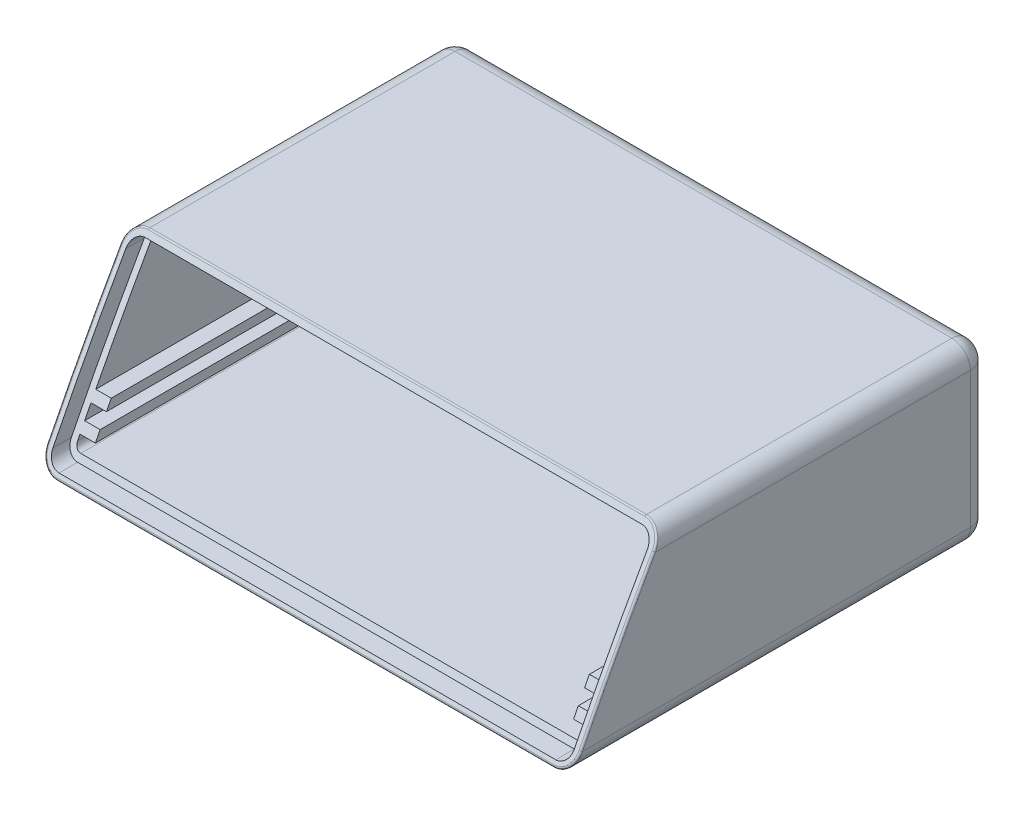
from build123d import *

# Parameters (mm, degrees)
SKETCH1_W                = 86.28
SKETCH1_H                = 67.5
BOSS_EXTRUDE1_DEPTH      = 28
FILLET1_R                = 3
SHELL1_T                 = -2
CUT_EXTRUDE1_DEPTH       = 97.784817508
SKETCH3_W                = 14.3
SKETCH3_H                = 16.7
SKETCH3_W_2              = 11.05
SKETCH3_H_2              = 14.049996967
CUT_EXTRUDE2_DEPTH       = 2
FILLET2_R                = 3
CUT_EXTRUDE3_REACH       = 165.279
CUT_EXTRUDE3_END_RADIUS  = 475
CUT_EXTRUDE3_START       = 80
FILLET3_R                = 0.3
BOSS_EXTRUDE2_REACH      = 85.135
BOSS_EXTRUDE2_END_RADIUS = 475
SKETCH5_W                = 2.5
SKETCH5_H                = 1.5


with BuildPart() as part:
    # Sketch1 → Boss-Extrude1 (new body)
    with BuildSketch(Plane(origin=(0, 0, 0), x_dir=(1, 0, 0), z_dir=(0, 1, 0))):
        Rectangle(SKETCH1_W, SKETCH1_H)
    extrude(amount=BOSS_EXTRUDE1_DEPTH)

    # Fillet1
    fillet1_edges = [part.edges().sort_by_distance(p)[0] for p in [
        (-43.14, 28, 0),
        (43.14, 28, 0),
        (-43.14, 0, 0),
        (43.14, 0, 0),
    ]]
    fillet(fillet1_edges, radius=FILLET1_R)

    # Shell1
    shell1_openings = [part.faces().sort_by_distance(p)[0] for p in [
        (0, 14, 33.75),
    ]]
    offset(amount=SHELL1_T, openings=shell1_openings, kind=Kind.INTERSECTION)

    # Sketch2 → Cut-Extrude1 (cut, through all)
    with BuildSketch(Plane.ZY.offset(43.14)):
        with BuildLine():
            Line((18.75, 28), (33.75, 28))
            Line((33.75, 28), (33.75, 0))
            ThreePointArc((33.75, 0), (26.484121584, 14.125422277), (18.75, 28))
        make_face()
    extrude(amount=-CUT_EXTRUDE1_DEPTH, mode=Mode.SUBTRACT)

    # Sketch3 → Cut-Extrude2 (cut)
    with BuildSketch(Plane(origin=(0, 0, -33.75), x_dir=(-1, 0, 0), z_dir=(0, 0, -1))):
        with Locations((0, 10.35)):
            Rectangle(SKETCH3_W, SKETCH3_H)
        with Locations((32.775, 10.175001517)):
            Rectangle(SKETCH3_W_2, SKETCH3_H_2)
    extrude(amount=-CUT_EXTRUDE2_DEPTH, mode=Mode.SUBTRACT)

    # Fillet2
    # the kernel refuses this fillet: 3 mm, written as the material it takes off along each edge
    with BuildSketch(Plane(origin=(40.14, 25, -33.75), x_dir=(1, 0, 0), z_dir=(0, -1, 0))) as fillet2_piece_1:
        with BuildLine():
            CenterArc((3 - FILLET2_R, FILLET2_R), FILLET2_R, 270, 90)
            Line((3, FILLET2_R), (3, 0))
            Line((3, 0), (3 - FILLET2_R, 0))
        make_face()
    revolve(axis=Axis((40.14, 25, -33.75), (0, 0, 1)), revolution_arc=90, mode=Mode.SUBTRACT)
    with BuildSketch(Plane(origin=(43.14, 3, -33.75), x_dir=(-1, 0, 0), z_dir=(0, 1, 0)), Plane(origin=(-43.14, 3, -33.75), x_dir=(0, 0, 1), z_dir=(0, 1, 0))) as fillet2_piece_2:
        with BuildLine():
            CenterArc((FILLET2_R, FILLET2_R), FILLET2_R, 180, 90)
            Line((0, FILLET2_R), (0, 0))
            Line((0, 0), (FILLET2_R, 0))
        make_face()
    extrude(amount=22, mode=Mode.SUBTRACT)
    with BuildSketch(Plane(origin=(40.14, 3, -33.75), x_dir=(1, 0, 0), z_dir=(0, 1, 0))) as fillet2_piece_3:
        with BuildLine():
            CenterArc((3 - FILLET2_R, -FILLET2_R), FILLET2_R, 0, 90)
            Line((3, -FILLET2_R), (3, 0))
            Line((3, 0), (3 - FILLET2_R, 0))
        make_face()
    revolve(axis=Axis((40.14, 3, -33.75), (0, 0, -1)), revolution_arc=90, mode=Mode.SUBTRACT)
    with BuildSketch(Plane(origin=(40.14, 0, -33.75), x_dir=(0, 1, 0), z_dir=(-1, 0, 0))) as fillet2_piece_4:
        with BuildLine():
            CenterArc((FILLET2_R, -FILLET2_R), FILLET2_R, 90, 90)
            Line((0, -FILLET2_R), (0, 0))
            Line((0, 0), (FILLET2_R, 0))
        make_face()
    extrude(amount=80.28, mode=Mode.SUBTRACT)
    with BuildSketch(Plane(origin=(-40.14, 3, -33.75), x_dir=(-1, 0, 0), z_dir=(0, 1, 0))) as fillet2_piece_5:
        with BuildLine():
            CenterArc((3 - FILLET2_R, FILLET2_R), FILLET2_R, 270, 90)
            Line((3 - FILLET2_R, 0), (3, 0))
            Line((3, 0), (3, FILLET2_R))
        make_face()
    revolve(axis=Axis((-40.14, 3, -33.75), (0, 0, 1)), revolution_arc=90, mode=Mode.SUBTRACT)
    with BuildSketch(Plane(origin=(-40.14, 25, -33.75), x_dir=(-1, 0, 0), z_dir=(0, -1, 0))) as fillet2_piece_6:
        with BuildLine():
            CenterArc((3 - FILLET2_R, -FILLET2_R), FILLET2_R, 0, 90)
            Line((3 - FILLET2_R, 0), (3, 0))
            Line((3, 0), (3, -FILLET2_R))
        make_face()
    revolve(axis=Axis((-40.14, 25, -33.75), (0, 0, -1)), revolution_arc=90, mode=Mode.SUBTRACT)
    with BuildSketch(Plane(origin=(40.14, 28, -33.75), x_dir=(0, -1, 0), z_dir=(-1, 0, 0))) as fillet2_piece_7:
        with BuildLine():
            CenterArc((FILLET2_R, FILLET2_R), FILLET2_R, 180, 90)
            Line((0, FILLET2_R), (0, 0))
            Line((0, 0), (FILLET2_R, 0))
        make_face()
    extrude(amount=80.28, mode=Mode.SUBTRACT)

    # Cut-Extrude3: up to this cylinder (the profile starts outside it)
    cut_extrude3_end = Plane(origin=(0, -210.179748667, -395.218864179), z_dir=(-1, 0, 0)) * Cylinder(CUT_EXTRUDE3_END_RADIUS, 1281.558, mode=Mode.PRIVATE)
    # Sketch4 → Cut-Extrude3 (cut, up to the surface)
    with BuildSketch(Plane.XY.offset(-31.75).offset(CUT_EXTRUDE3_START), mode=Mode.PRIVATE) as cut_extrude3_sk1:
        with BuildLine():
            Line((-7.15, 1), (7.15, 1))
            Line((7.15, 1), (40.14, 1))
            ThreePointArc((40.14, 1), (41.554213562, 1.585786438), (42.14, 3))
            Line((42.14, 3), (42.14, 25))
            ThreePointArc((42.14, 25), (41.554213562, 26.414213562), (40.14, 27))
            Line((40.14, 27), (-40.14, 27))
            ThreePointArc((-40.14, 27), (-41.554213562, 26.414213562), (-42.14, 25))
            Line((-42.14, 25), (-42.14, 3))
            ThreePointArc((-42.14, 3), (-41.554213562, 1.585786438), (-40.14, 1))
            Line((-40.14, 1), (-7.15, 1))
        make_face()
        with BuildLine():
            Line((-7.15, 2), (7.15, 2))
            Line((7.15, 2), (40.14, 2))
            ThreePointArc((40.14, 2), (40.847106781, 2.292893219), (41.14, 3))
            Line((41.14, 3), (41.14, 25))
            ThreePointArc((41.14, 25), (40.847106781, 25.707106781), (40.14, 26))
            Line((40.14, 26), (-40.14, 26))
            ThreePointArc((-40.14, 26), (-40.847106781, 25.707106781), (-41.14, 25))
            Line((-41.14, 25), (-41.14, 3))
            ThreePointArc((-41.14, 3), (-40.847106781, 2.292893219), (-40.14, 2))
            Line((-40.14, 2), (-7.15, 2))
        make_face(mode=Mode.SUBTRACT)
    cut_extrude3_tool1 = extrude(cut_extrude3_sk1.sketch, amount=-CUT_EXTRUDE3_REACH, mode=Mode.PRIVATE) - cut_extrude3_end
    add(cut_extrude3_tool1.solids().sort_by_distance((0, 26.118007, 48.25))[0], mode=Mode.SUBTRACT)

    # Fillet3
    fillet3_edges = [part.edges().sort_by_distance(p)[0] for p in [
        (0, 0, 33.75),
        (-43.14, 14.077394683, 26.509847108),
        (42.334331752, 27.045704827, 19.301590008),
        (42.31956234, 0.938566512, 33.285609346),
        (-42.31956234, 0.938566512, 33.285609346),
        (-42.334331752, 27.045704827, 19.301590008),
        (43.14, 14.077394683, 26.509847108),
        (0, 28, 18.75),
    ]]
    fillet(fillet3_edges, radius=FILLET3_R)

    # Boss-Extrude2: up to this cylinder (the profile starts inside it)
    boss_extrude2_end = Plane(origin=(0, -210.179748667, -395.218864179), z_dir=(-1, 0, 0)) * Cylinder(BOSS_EXTRUDE2_END_RADIUS, 1201.05, mode=Mode.PRIVATE)
    # Sketch5 → Boss-Extrude2 (add, up to the surface)
    with BuildSketch(Plane.XY.offset(-31.75), mode=Mode.PRIVATE) as boss_extrude2_sk1:
        with Locations((39.89, 4.5)):
            Rectangle(SKETCH5_W, SKETCH5_H)
    boss_extrude2_tool1 = extrude(boss_extrude2_sk1.sketch, amount=BOSS_EXTRUDE2_REACH, mode=Mode.PRIVATE) & boss_extrude2_end
    add(boss_extrude2_tool1.solids().sort_by_distance((39.89, 4.5, -31.75))[0])
    # Sketch5 → Boss-Extrude2 (add, up to the surface)
    with BuildSketch(Plane.XY.offset(-31.75), mode=Mode.PRIVATE) as boss_extrude2_sk2:
        with Locations((39.89, 8)):
            Rectangle(SKETCH5_W, SKETCH5_H)
    boss_extrude2_tool2 = extrude(boss_extrude2_sk2.sketch, amount=BOSS_EXTRUDE2_REACH, mode=Mode.PRIVATE) & boss_extrude2_end
    add(boss_extrude2_tool2.solids().sort_by_distance((39.89, 8, -31.75))[0])
    # Sketch5 → Boss-Extrude2 (add, up to the surface)
    with BuildSketch(Plane.XY.offset(-31.75), mode=Mode.PRIVATE) as boss_extrude2_sk3:
        with Locations((-39.89, 8)):
            Rectangle(SKETCH5_W, SKETCH5_H)
    boss_extrude2_tool3 = extrude(boss_extrude2_sk3.sketch, amount=BOSS_EXTRUDE2_REACH, mode=Mode.PRIVATE) & boss_extrude2_end
    add(boss_extrude2_tool3.solids().sort_by_distance((-39.89, 8, -31.75))[0])
    # Sketch5 → Boss-Extrude2 (add, up to the surface)
    with BuildSketch(Plane.XY.offset(-31.75), mode=Mode.PRIVATE) as boss_extrude2_sk4:
        with Locations((-39.89, 4.5)):
            Rectangle(SKETCH5_W, SKETCH5_H)
    boss_extrude2_tool4 = extrude(boss_extrude2_sk4.sketch, amount=BOSS_EXTRUDE2_REACH, mode=Mode.PRIVATE) & boss_extrude2_end
    add(boss_extrude2_tool4.solids().sort_by_distance((-39.89, 4.5, -31.75))[0])


solid = part.part
